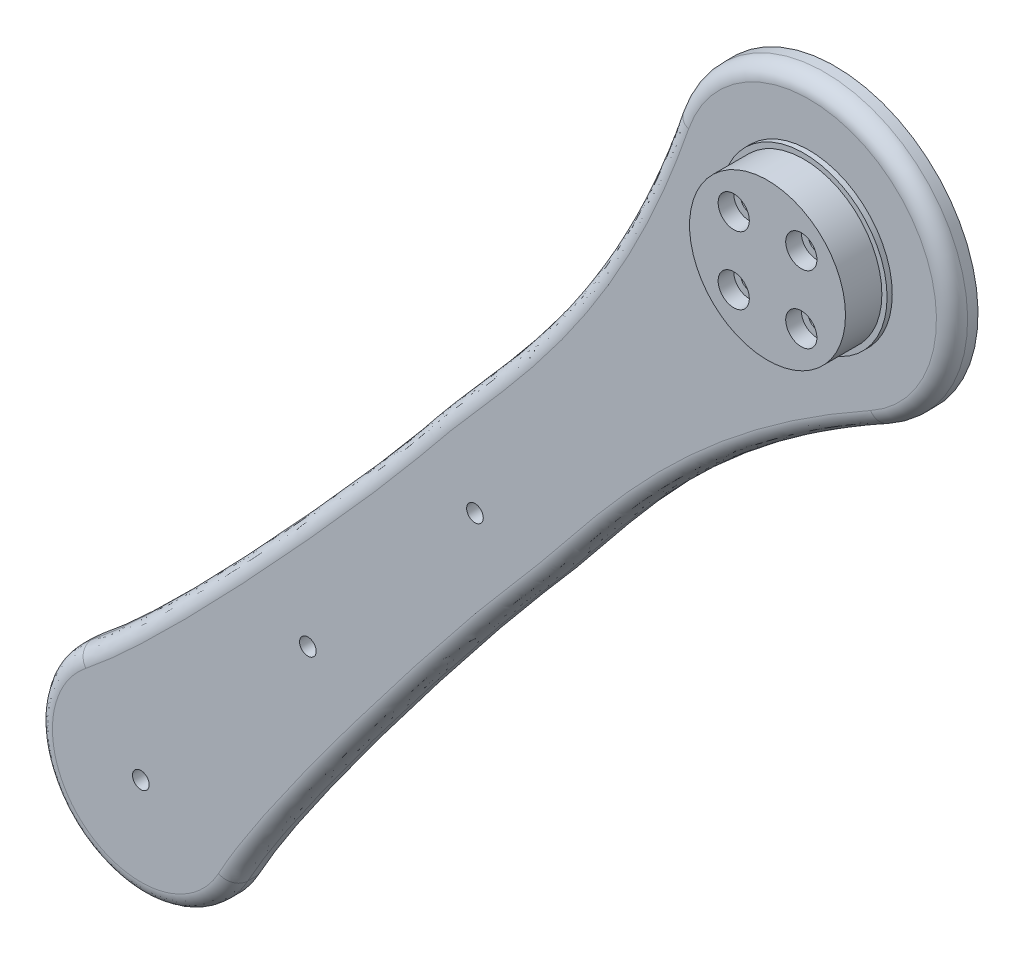
from build123d import *

# Parameters (mm, degrees)
SKETCH1_R           = 1.6
BOSS_EXTRUDE1_DEPTH = 5
SKETCH2_R           = 16
SKETCH2_R_2         = 1.6
BOSS_EXTRUDE2_DEPTH = 1
SKETCH3_R           = 15
SKETCH3_R_2         = 1.6
BOSS_EXTRUDE3_DEPTH = 7
SKETCH4_R           = 3
CUT_EXTRUDE1_DEPTH  = 3
VARFILLET1_R        = 3


with BuildPart() as part:
    # Sketch1 → Boss-Extrude1 (new body)
    with BuildSketch(Plane.XY.offset(31)):
        with BuildLine():
            ThreePointArc((155.019115612, -142.985112199), (159.394881243, -97.849485606), (115.704809966, -109.996492831))
            add(Edge.make_bspline(
                [(115.704809966, -109.996492831), (101.94879758, -150.116707379), (78.178790791, -171.772825461), (58.717079478, -197.082387325), (16.356999542, -244.049515564), (0.72448619, -256.46124476)],
                knots=[0, 0, 0, 0, 0.619090324, 0.719090324, 1, 1, 1, 1], degree=3))
            ThreePointArc((0.72448619, -256.46124476), (0.304947846, -287.445485278), (30.74561606, -281.651963762))
            add(Edge.make_bspline(
                [(155.019115612, -142.985112199), (117.897123756, -163.498941991), (100.69762913, -190.668374405), (79.152067085, -214.229377889), (40.254225745, -264.101669257), (30.74561606, -281.651963762)],
                knots=[0, 0, 0, 0, 0.619090324, 0.719090324, 1, 1, 1, 1], degree=3))
        make_face()
        with Locations((135.218221977, -112.415707792)):
            Circle(SKETCH1_R, mode=Mode.SUBTRACT)
        with Locations((148.218221977, -112.415707792)):
            Circle(SKETCH1_R, mode=Mode.SUBTRACT)
        with Locations((148.218221977, -125.415707792)):
            Circle(SKETCH1_R, mode=Mode.SUBTRACT)
        with Locations((135.218221977, -125.415707792)):
            Circle(SKETCH1_R, mode=Mode.SUBTRACT)
        with Locations((77.439461008, -195.520152104)):
            Circle(SKETCH1_R, mode=Mode.SUBTRACT)
        with Locations((45.300080524, -233.82237426)):
            Circle(SKETCH1_R, mode=Mode.SUBTRACT)
        with Locations((13.16070004, -272.124596416)):
            Circle(SKETCH1_R, mode=Mode.SUBTRACT)
    extrude(amount=BOSS_EXTRUDE1_DEPTH)

    # Sketch2 → Boss-Extrude2 (add)
    with BuildSketch(Plane.XY.offset(36)):
        with Locations((141.718221977, -118.915707792)):
            Circle(SKETCH2_R)
        with Locations((135.218221977, -125.415707792)):
            Circle(SKETCH2_R_2, mode=Mode.SUBTRACT)
        with Locations((148.218221977, -125.415707792)):
            Circle(SKETCH2_R_2, mode=Mode.SUBTRACT)
        with Locations((135.218221977, -112.415707792)):
            Circle(SKETCH2_R_2, mode=Mode.SUBTRACT)
        with Locations((148.218221977, -112.415707792)):
            Circle(SKETCH2_R_2, mode=Mode.SUBTRACT)
    extrude(amount=BOSS_EXTRUDE2_DEPTH)

    # Sketch3 → Boss-Extrude3 (add)
    with BuildSketch(Plane.XY.offset(37)):
        with Locations((141.718221977, -118.915707792)):
            Circle(SKETCH3_R)
        with Locations((135.218221977, -125.415707792)):
            Circle(SKETCH3_R_2, mode=Mode.SUBTRACT)
        with Locations((148.218221977, -125.415707792)):
            Circle(SKETCH3_R_2, mode=Mode.SUBTRACT)
        with Locations((135.218221977, -112.415707792)):
            Circle(SKETCH3_R_2, mode=Mode.SUBTRACT)
        with Locations((148.218221977, -112.415707792)):
            Circle(SKETCH3_R_2, mode=Mode.SUBTRACT)
    extrude(amount=BOSS_EXTRUDE3_DEPTH)

    # Sketch4 → Cut-Extrude1 (cut)
    with BuildSketch(Plane.XY.offset(44)):
        with Locations((135.218221977, -112.415707792)):
            Circle(SKETCH4_R)
        with Locations((148.218221977, -112.415707792)):
            Circle(SKETCH4_R)
        with Locations((148.218221977, -125.415707792)):
            Circle(SKETCH4_R)
        with Locations((135.218221977, -125.415707792)):
            Circle(SKETCH4_R)
    extrude(amount=-CUT_EXTRUDE1_DEPTH, mode=Mode.SUBTRACT)

    # VarFillet1
    varfillet1_edges = [part.edges().sort_by_distance(p)[0] for p in [
        (0.304947846, -287.445485278, 36),
        (65.360846316, -188.427744165, 36),
        (86.521548764, -206.183681785, 36),
    ]]
    fillet(varfillet1_edges, radius=VARFILLET1_R)


solid = part.part
